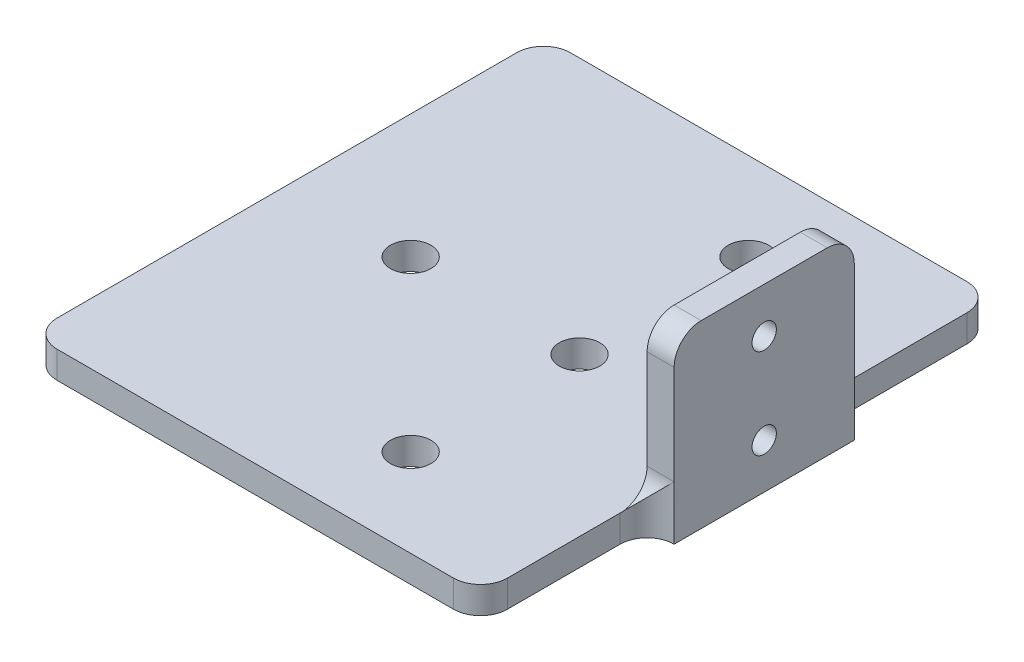
from build123d import *

# Parameters (mm, degrees)
SKETCH1_W                      = 50
SKETCH1_H                      = 57
BOSS_EXTRUDE1_DEPTH            = 3
F_4_5_4_5_DIAMETER_HOLE1_D     = 4.5
F_4_5_4_5_DIAMETER_HOLE1_DEPTH = 15
F_4_5_4_5_DIAMETER_HOLE1_TIP   = 1.351936393
SKETCH4_W                      = 20
SKETCH4_H                      = 20
BOSS_EXTRUDE2_DEPTH            = 3
F_2_7_2_7_DIAMETER_HOLE1_D     = 2.7
F_2_7_2_7_DIAMETER_HOLE1_DEPTH = 15
F_2_7_2_7_DIAMETER_HOLE1_TIP   = 0.811161836
FILLET1_R                      = 3
FILLET2_R                      = 3


# Some blends are built 0.0001 mm under size
with BuildPart() as part:
    # Sketch1 → Boss-Extrude1 (new body)
    with BuildSketch(Plane(origin=(0, 0, 0), x_dir=(1, 0, 0), z_dir=(0, 1, 0))):
        Rectangle(SKETCH1_W, SKETCH1_H)
    extrude(amount=BOSS_EXTRUDE1_DEPTH)

    # Ø4.5 (4.5) Diameter Hole1
    with Locations(Plane(origin=(0, 3, 0), x_dir=(1, 0, 0), z_dir=(0, 1, 0))):
        with Locations((-11.25, 0), (7.5, 0), (7.5, 18.75), (7.5, -18.75)):
            Hole(F_4_5_4_5_DIAMETER_HOLE1_D / 2, depth=F_4_5_4_5_DIAMETER_HOLE1_DEPTH)
            with Locations((0, 0, -(F_4_5_4_5_DIAMETER_HOLE1_DEPTH + F_4_5_4_5_DIAMETER_HOLE1_TIP / 2))):  # 118° drill point
                Cone(0, F_4_5_4_5_DIAMETER_HOLE1_D / 2, F_4_5_4_5_DIAMETER_HOLE1_TIP, mode=Mode.SUBTRACT)

    # Sketch4 → Boss-Extrude2 (add)
    with BuildSketch(Plane(origin=(25, 0, 0), x_dir=(0, 0, -1), z_dir=(1, 0, 0))):
        with Locations((0, 10)):
            Rectangle(SKETCH4_W, SKETCH4_H)
    extrude(amount=BOSS_EXTRUDE2_DEPTH)

    # Ø2.7 (2.7) Diameter Hole1
    with Locations(Plane(origin=(28, 0, 0), x_dir=(0, 0, -1), z_dir=(1, 0, 0))):
        with Locations((0, 5), (0, 15)):
            Hole(F_2_7_2_7_DIAMETER_HOLE1_D / 2, depth=F_2_7_2_7_DIAMETER_HOLE1_DEPTH)
            with Locations((0, 0, -(F_2_7_2_7_DIAMETER_HOLE1_DEPTH + F_2_7_2_7_DIAMETER_HOLE1_TIP / 2))):  # 118° drill point
                Cone(0, F_2_7_2_7_DIAMETER_HOLE1_D / 2, F_2_7_2_7_DIAMETER_HOLE1_TIP, mode=Mode.SUBTRACT)

    # Fillet1
    fillet1_edges = [part.edges().sort_by_distance(p)[0] for p in [
        (-25, 1.5, 28.5),
        (-25, 1.5, -28.5),
        (25, 1.5, -28.5),
        (25, 1.5, -10),
        (25, 1.5, 28.5),
        (25, 1.5, 10),
        (26.5, 20, -10),
        (26.5, 20, 10),
    ]]
    fillet(fillet1_edges, radius=FILLET1_R - 0.0001)  # a hair under: the kernel refuses the full size

    # Fillet2
    # the kernel refuses this fillet: 3 mm, written as the material it adds along each edge
    with BuildSketch(Plane(origin=(25, 3, 10), x_dir=(0, 0, 1), z_dir=(1, 0, 0))) as fillet2_piece_1_section:
        with BuildLine():
            CenterArc((FILLET2_R, -FILLET2_R), FILLET2_R, 90, 90)
            Line((0, -FILLET2_R), (0, 0))
            Line((0, 0), (FILLET2_R, 0))
        make_face()
    fillet2_piece_1 = extrude(amount=10.4999, mode=Mode.PRIVATE)
    fillet2_piece_1 = split(fillet2_piece_1, bisect_by=Plane(origin=(28, 3.856738297, 10.392281227), z_dir=(-1, 0, 0)), keep=Keep.TOP, mode=Mode.PRIVATE)
    fillet2_piece_1 = fillet2_piece_1 - Plane(origin=(27.9999, 3.856738297, 12.9999), x_dir=(0, 0, -1), z_dir=(0, 1, 0)) * Cylinder(2.9999, 33, mode=Mode.PRIVATE)
    add(fillet2_piece_1)
    with BuildSketch(Plane(origin=(25, 3, -10), x_dir=(0, 0, -1), z_dir=(1, 0, 0))) as fillet2_piece_2_section:
        with BuildLine():
            CenterArc((FILLET2_R, FILLET2_R), FILLET2_R, 180, 90)
            Line((0, FILLET2_R), (0, 0))
            Line((0, 0), (FILLET2_R, 0))
        make_face()
    fillet2_piece_2 = extrude(amount=10.4999, mode=Mode.PRIVATE)
    fillet2_piece_2 = fillet2_piece_2 - Plane(origin=(27.9999, 3.856737678, -12.9999), x_dir=(-1, 0, 0), z_dir=(0, -1, 0)) * Cylinder(2.9999, 33, mode=Mode.PRIVATE)
    fillet2_piece_2 = split(fillet2_piece_2, bisect_by=Plane(origin=(28, 3.856737678, -10.392309052), z_dir=(-1, 0, 0)), keep=Keep.TOP, mode=Mode.PRIVATE)
    add(fillet2_piece_2)


solid = part.part
